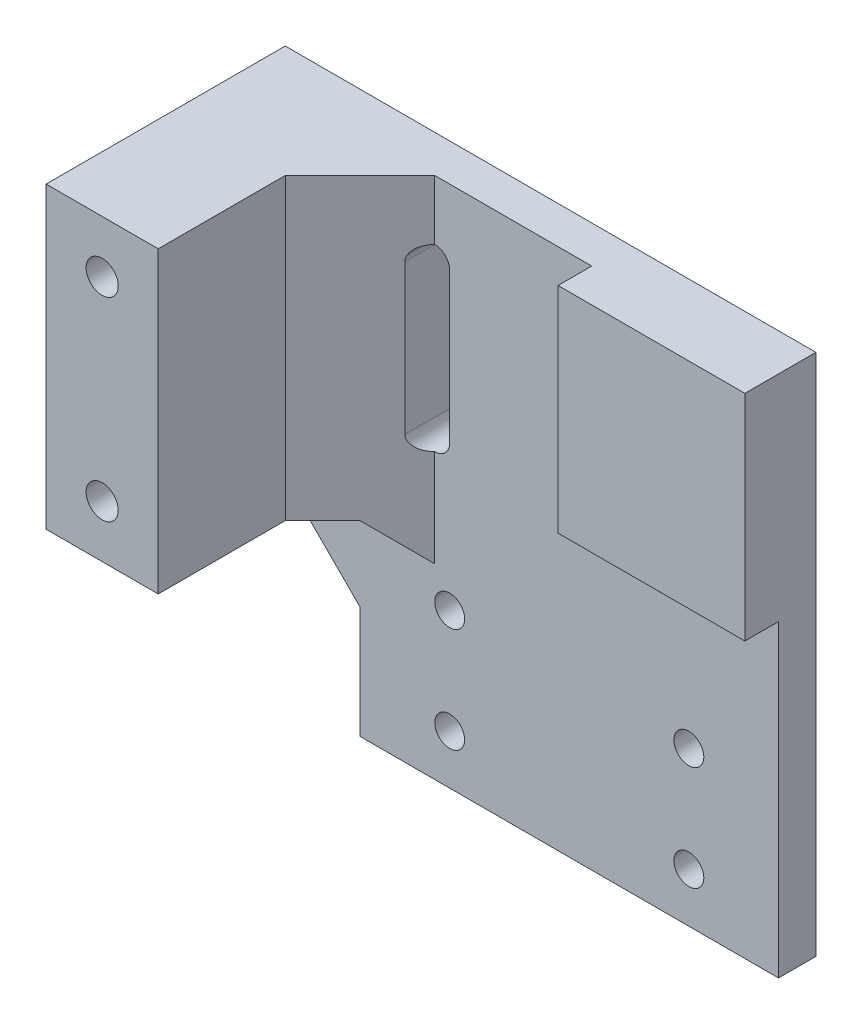
from build123d import *

# Parameters (mm, degrees)
SKETCH_1_W          = 56
SKETCH_1_H          = 70
EXTRUDE_1_DEPTH     = 5
SKETCH_2_R          = 2
CUT_EXTRUDE_1_DEPTH = 5
SKETCH_5_W          = 25
SKETCH_5_H          = 28.7
EXTRUDE_3_DEPTH     = 4.5
SKETCH_6_W          = 32
SKETCH_6_H          = 40
EXTRUDE_4_DEPTH     = 15
SKETCH_9_R          = 2.15
CUT_EXTRUDE_2_DEPTH = 10
CUT_EXTRUDE_3_DEPTH = 10
CHAMFER_START       = -5
CHAMFER_1_DEPTH     = 40
CHAMFER_1_2_DEPTH   = 10
CHAMFER_START_2     = 25
CHAMFER_1_3_DEPTH   = 10
CHAMFER_START_3     = 5
CHAMFER_1_4_DEPTH   = 3
CHAMFER_2_SIZE      = 15
CHAMFER_3_SIZE      = 5


with BuildPart() as part:
    # 草图1 → 凸台-拉伸1 (new body)
    with BuildSketch(Plane.XY):
        Rectangle(SKETCH_1_W, SKETCH_1_H)
    extrude(amount=EXTRUDE_1_DEPTH)

    # 草图2 → 切除-拉伸1 (cut)
    with BuildSketch(Plane.XY.offset(5)):
        with Locations((-16, -28.4)):
            Circle(SKETCH_2_R)
        with Locations((-16, -14.4)):
            Circle(SKETCH_2_R)
    cut_extrude_1 = extrude(amount=-CUT_EXTRUDE_1_DEPTH, mode=Mode.SUBTRACT)

    # 镜向1: 切除-拉伸1 across plane
    add(cut_extrude_1.mirror(Plane(origin=(0, 0, 0), x_dir=(0, 0, 1), z_dir=(1, 0, 0))), mode=Mode.SUBTRACT)

    # 草图5 → 凸台-拉伸3 (add)
    with BuildSketch(Plane.XY.offset(5)):
        with Locations((15.5, 20.65)):
            Rectangle(SKETCH_5_W, SKETCH_5_H)
    extrude(amount=EXTRUDE_3_DEPTH)

    # 草图6 → 凸台-拉伸4 (add)
    with BuildSketch(Plane.ZY.offset(28)):
        with Locations((16, 15)):
            Rectangle(SKETCH_6_W, SKETCH_6_H)
    extrude(amount=EXTRUDE_4_DEPTH)

    # 草图9 → 切除-拉伸2 (cut)
    with BuildSketch(Plane.XY.offset(32)):
        with Locations((-35.5, 28)):
            Circle(SKETCH_9_R)
        with Locations(Location((-35.5, 2, 0), (0, 0, 180))):
            Circle(SKETCH_9_R)
    extrude(amount=-CUT_EXTRUDE_2_DEPTH, mode=Mode.SUBTRACT)

    # 草图10 → 切除-拉伸3 (cut)
    with BuildSketch(Plane.XY.offset(5)):
        with BuildLine():
            Line((-20, 5), (-20, 25))
            ThreePointArc((-20, 25), (-18, 27), (-16, 25))
            Line((-16, 25), (-16, 5))
            ThreePointArc((-16, 5), (-18, 3), (-20, 5))
        make_face()
    extrude(amount=-CUT_EXTRUDE_3_DEPTH, mode=Mode.SUBTRACT)

    # 倒角1: read off the stored shape, not the designer's step
    # 倒角1 outline → 倒角1 (add)
    with BuildSketch(Plane(origin=(0, 0, 0), x_dir=(1, 0, 0), z_dir=(0, 1, 0)).offset(CHAMFER_START)):
        Polygon((-20, -7), (-20, -5), (-28, -5), (-28, -15), align=None)
    extrude(amount=CHAMFER_1_DEPTH)

    # Chamfer 1 2 outline → Chamfer 1 2 (add)
    with BuildSketch(Plane(origin=(0, 0, 0), x_dir=(1, 0, 0), z_dir=(0, 1, 0)).offset(CHAMFER_START)):
        Polygon((-18, -5), (-20, -5), (-20, -7), align=None)
    extrude(amount=CHAMFER_1_2_DEPTH)

    # Chamfer 1 3 outline → Chamfer 1 3 (add)
    with BuildSketch(Plane(origin=(0, 0, 0), x_dir=(1, 0, 0), z_dir=(0, 1, 0)).offset(CHAMFER_START_2)):
        Polygon((-18, -5), (-20, -5), (-20, -7), align=None)
    extrude(amount=CHAMFER_1_3_DEPTH)

    # Chamfer 1 4 outline → Chamfer 1 4 (cut)
    with BuildSketch(Plane.XY.offset(CHAMFER_START_3)):
        with BuildLine():
            Line((-16, 5), (-20, 5))
            ThreePointArc((-20, 5), (-18, 3), (-16, 5))
        make_face()
        with BuildLine():
            Line((-20, 25), (-16, 25))
            ThreePointArc((-16, 25), (-18, 27), (-20, 25))
        make_face()
    extrude(amount=CHAMFER_1_4_DEPTH, mode=Mode.SUBTRACT)

    # 倒角2
    chamfer_2_edges = [part.edges().sort_by_distance(p)[0] for p in [
        (-28, -5, 2.5),
    ]]
    chamfer(chamfer_2_edges, length=CHAMFER_2_SIZE - 0.0001)  # a hair under: the kernel refuses the full size

    # 倒角3
    chamfer_3_edges = [part.edges().sort_by_distance(p)[0] for p in [
        (-30.49995, -5, 5),
    ]]
    chamfer(chamfer_3_edges, length=CHAMFER_3_SIZE)


solid = part.part
